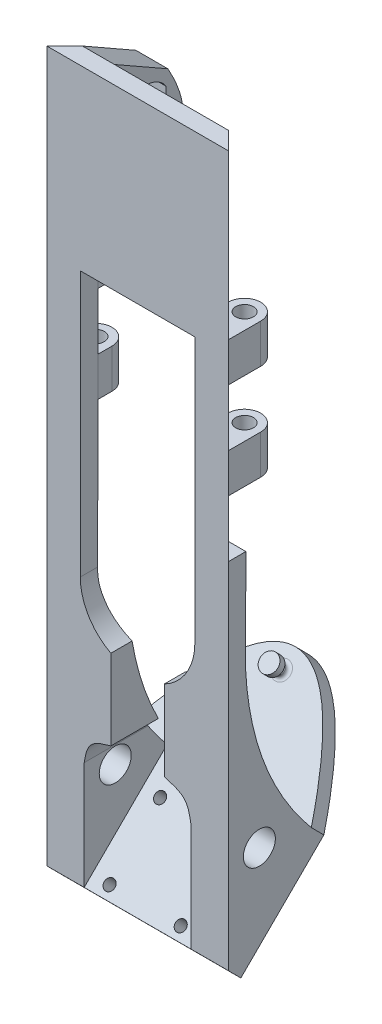
from build123d import *

# Parameters (mm, degrees)
SKETCH1_R           = 2.5
BOSS_EXTRUDE1_DEPTH = 200
SKETCH4_W           = 8.702747253
SKETCH4_H           = 30
SKETCH4_H_2         = 16
CUT_EXTRUDE4_DEPTH  = 207.854454345
CHAMFER2_SIZE       = 5
CHAMFER2_SIZE_2     = 5.019354123
BOSS_EXTRUDE2_DEPTH = 51
CUT_EXTRUDE5_DEPTH  = 203.964396132
SKETCH8_R           = 4.5
CUT_EXTRUDE6_DEPTH  = 208.714458096
BOSS_EXTRUDE3_DEPTH = 5
BOSS_EXTRUDE4_START = -13
SKETCH10_R          = 1.5
BOSS_EXTRUDE4_DEPTH = 16
CHAMFER11_SIZE      = 5
SKETCH11_R          = 2.5
BOSS_EXTRUDE5_DEPTH = 2
FILLET1_R           = 1
BOSS_EXTRUDE6_START = -5
BOSS_EXTRUDE6_DEPTH = 9
SKETCH14_R          = 1.5
CUT_EXTRUDE7_DEPTH  = 10
CUT_EXTRUDE8_START  = -84
CUT_EXTRUDE8_DEPTH  = 16


# Some blends are built 0.0001 mm under size
with BuildPart() as part:
    # Sketch1 → Boss-Extrude1 (new body)
    with BuildSketch(Plane(origin=(0, 0, 0), x_dir=(1, 0, 0), z_dir=(0, 1, 0))):
        with BuildLine():
            Line((-25.5, 5), (-25.5, 9.107142857))
            ThreePointArc((-25.5, 9.107142857), (-20.904395604, 13.702747253), (-16.308791209, 9.107142857))
            Line((-16.308791209, 9.107142857), (-16.308791209, 5))
            Line((-16.308791209, 5), (16.308791209, 5))
            Line((16.308791209, 5), (16.308791209, 9.107142857))
            ThreePointArc((16.308791209, 9.107142857), (20.904395604, 13.702747253), (25.5, 9.107142857))
            Line((25.5, 9.107142857), (25.5, 5))
            Line((25.5, 5), (25.5, 0))
            Line((25.5, 0), (-25.5, 0))
            Line((-25.5, 0), (-25.5, 5))
        make_face()
        with Locations(Location((-20.96043956, 9.107142857, 0), (0, 0, 270))):
            Circle(SKETCH1_R, mode=Mode.SUBTRACT)
        with Locations(Location((20.96043956, 9.107142857, 0), (0, 0, 90))):
            Circle(SKETCH1_R, mode=Mode.SUBTRACT)
    extrude(amount=BOSS_EXTRUDE1_DEPTH)

    # Sketch4 → Cut-Extrude4 (cut, through all)
    with BuildSketch(Plane(origin=(25.5, 0, 0), x_dir=(0, 0, -1), z_dir=(1, 0, 0))):
        with Locations((9.351373626, 185)):
            Rectangle(SKETCH4_W, SKETCH4_H)
        with Locations((9.351373626, 162)):
            Rectangle(SKETCH4_W, SKETCH4_H_2)
        with Locations((9.351373626, 135)):
            Rectangle(SKETCH4_W, SKETCH4_H_2)
        with Locations((9.351373626, 108)):
            Rectangle(SKETCH4_W, SKETCH4_H_2)
        Polygon((5, 100), (5, 116), (4.553571429, 0), (13.702747253, 0), (13.702747253, 100), align=None)
    extrude(amount=-CUT_EXTRUDE4_DEPTH, mode=Mode.SUBTRACT)

    # Chamfer2
    # the kernel refuses this chamfer: 5.019354123, 5 mm, written as the material it takes off along each edge
    with BuildSketch(Plane(origin=(38.409512828, 0, -4.553571429), x_dir=(0, 0.9995054486557426, -0.03144611434633402), z_dir=(-1, 0, 0))) as chamfer2_piece_1:
        Polygon((CHAMFER2_SIZE * 0.999619067011, -CHAMFER2_SIZE * 0.0275992910832), (-CHAMFER2_SIZE_2 * 0.0314461143481, -CHAMFER2_SIZE_2 * 0.999505448712), (0, 0), align=None)
    extrude(amount=76.819025655, mode=Mode.SUBTRACT)

    # Sketch7 → Boss-Extrude2 (add, through all)
    with BuildSketch(Plane.ZY.offset(25.5)):
        with BuildLine():
            Line((-4.572813897, 4.999962973), (-23.330153181, 23.613479688))
            add(Edge.make_bspline(
                [(-23.330153181, 23.613479688), (-6.160592573, 44.077045925), (-4.829970579, 71.819555154)],
                knots=[0, 0, 0, 1, 1, 1], degree=2))
            Line((-4.829970579, 71.819555154), (-4.572813897, 4.999962973))
        make_face()
    extrude(amount=-BOSS_EXTRUDE2_DEPTH)

    # Sketch5 → Cut-Extrude5 (cut, through all)
    with BuildSketch(Plane.XY):
        with BuildLine():
            Line((-16.096845958, 150), (-16.096845958, 75.462211289))
            ThreePointArc((-16.096845958, 75.462211289), (-13.78105211, 67.144095363), (-7.5, 61.219372745))
            Line((-7.5, 61.219372745), (-7.5, 38.659982869))
            add(Edge.make_bspline(
                [(-7.5, 38.659982869), (-9.795642151, 38.017223862), (-13.947085411, 36.854857355), (-14.674726057, 32.692610158), (-15, 30.831979414)],
                knots=[0, 0, 0, 0, 0.552974474, 1, 1, 1, 1], degree=3))
            Line((-15, 30.831979414), (-15, 0))
            Line((-15, 0), (15, 0))
            Line((15, 0), (15, 30.831979414))
            add(Edge.make_bspline(
                [(7.5, 38.659982869), (9.795642151, 38.017223862), (13.947085411, 36.854857355), (14.674726057, 32.692610158), (15, 30.831979414)],
                knots=[0, 0, 0, 0, 0.552974474, 1, 1, 1, 1], degree=3))
            Line((7.5, 38.659982869), (7.5, 61.219372745))
            ThreePointArc((7.5, 61.219372745), (13.78105211, 67.144095363), (16.096845958, 75.462211289))
            Line((16.096845958, 75.462211289), (16.096845958, 150))
            Line((16.096845958, 150), (-16.096845958, 150))
        make_face()
    extrude(amount=-CUT_EXTRUDE5_DEPTH, mode=Mode.SUBTRACT)

    # Sketch8 → Cut-Extrude6 (cut, through all)
    with BuildSketch(Plane.ZY.offset(25.5)):
        with Locations((-8.727098944, 26.028021636)):
            Circle(SKETCH8_R)
    extrude(amount=-CUT_EXTRUDE6_DEPTH, mode=Mode.SUBTRACT)

    # Sketch9 → Boss-Extrude3 (add)
    with BuildSketch(Plane(origin=(0, 0.232884449, 0.231098799), x_dir=(1, 0, 0), z_dir=(0, -0.7098228406915363, -0.7043802487524746))):
        with BuildLine():
            Line((-25.5, -0.325572503), (-25.5, -33.193144301))
            add(Edge.make_bspline(
                [(-25.5, -33.193144301), (0, -92.295534264), (25.5, -33.193144301)],
                knots=[0, 0, 0, 1, 1, 1], degree=2))
            Line((25.5, -33.193144301), (25.5, -0.325572503))
            Line((25.5, -0.325572503), (-25.5, -0.325572503))
        make_face()
    extrude(amount=BOSS_EXTRUDE3_DEPTH)

    # Sketch10 → Boss-Extrude4 (add)
    with BuildSketch(Plane(origin=(0, 0.232884449, 0.231098799), x_dir=(1, 0, 0), z_dir=(0, 0.7098228406915363, 0.7043802487524746)).offset(BOSS_EXTRUDE4_START)):
        with Locations(Location((0, 57.339451639, 0), (0, 0, 270))):
            Circle(SKETCH10_R)
    extrude(amount=BOSS_EXTRUDE4_DEPTH)

    # Chamfer11
    chamfer11_edges = [part.edges().sort_by_distance(p)[0] for p in [
        (25.5, 135, -5),
        (25.5, 177, -5),
        (-25.5, 135, -5),
        (-25.5, 177, -5),
    ]]
    chamfer(chamfer11_edges, length=CHAMFER11_SIZE - 0.0001)  # a hair under: the kernel refuses the full size

    # Sketch11 → Boss-Extrude5 (add)
    with BuildSketch(Plane(origin=(0, 2.362352971, 2.344239545), x_dir=(1, 0, 0), z_dir=(0, 0.7098228406915363, 0.7043802487524746))):
        with Locations(Location((0, 57.339451639, 0), (0, 0, 270))):
            Circle(SKETCH11_R)
    extrude(amount=BOSS_EXTRUDE5_DEPTH)

    # Fillet1
    fillet1_edges = [part.edges().sort_by_distance(p)[0] for p in [
        (0, 41.678232031, -41.534487908),
        (0, 43.807700553, -39.421347162),
    ]]
    fillet(fillet1_edges, radius=FILLET1_R - 0.0001)  # a hair under: the kernel refuses the full size

    # Sketch13 → Boss-Extrude6 (add)
    with BuildSketch(Plane.ZY.offset(25.5).offset(BOSS_EXTRUDE6_START)):
        with BuildLine():
            Line((-5, 171), (-5, 200))
            Line((-5, 200), (-20.018483641, 191.448737676))
            add(Edge.make_bspline(
                [(-5, 171), (-33.25422997, 167.518026698), (-20.018483641, 191.448737676)],
                knots=[0, 0, 0, 1, 1, 1], degree=2))
        make_face()
        with BuildLine():
            Line((-19.5, 180.535898385), (-19.5, 187.464101615))
            ThreePointArc((-19.5, 187.464101615), (-14, 190.5), (-8.5, 187.464101615))
            Line((-8.5, 187.464101615), (-8.5, 180.535898385))
            ThreePointArc((-8.5, 180.535898385), (-14, 177.5), (-19.5, 180.535898385))
        make_face(mode=Mode.SUBTRACT)
    extrude(amount=-BOSS_EXTRUDE6_DEPTH)

    # Sketch14 → Cut-Extrude7 (cut)
    with BuildSketch(Plane(origin=(0, -3.316229755, -3.290802445), x_dir=(1, 0, 0), z_dir=(0, -0.7098228406915363, -0.7043802487524746))):
        with Locations(Location((-10, -3.325572503, 0), (0, 0, 270))):
            Circle(SKETCH14_R)
        with Locations(Location((-10, -23.325572503, 0), (0, 0, 270))):
            Circle(SKETCH14_R)
        with Locations(Location((10, -23.325572503, 0), (0, 0, 90))):
            Circle(SKETCH14_R)
        with Locations(Location((10, -3.325572503, 0), (0, 0, 90))):
            Circle(SKETCH14_R)
    extrude(amount=-CUT_EXTRUDE7_DEPTH, mode=Mode.SUBTRACT)

    # Sketch15 → Cut-Extrude8 (cut)
    with BuildSketch(Plane(origin=(0, 200, 0), x_dir=(1, 0, 0), z_dir=(0, 1, 0)).offset(CUT_EXTRUDE8_START)):
        Polygon((25.5, 0), (20.5, 5), (25.5, 5), align=None)
        Polygon((-20.5, 5), (-25.5, 0), (-25.5, 5), align=None)
    extrude(amount=-CUT_EXTRUDE8_DEPTH, mode=Mode.SUBTRACT)


solid = part.part
